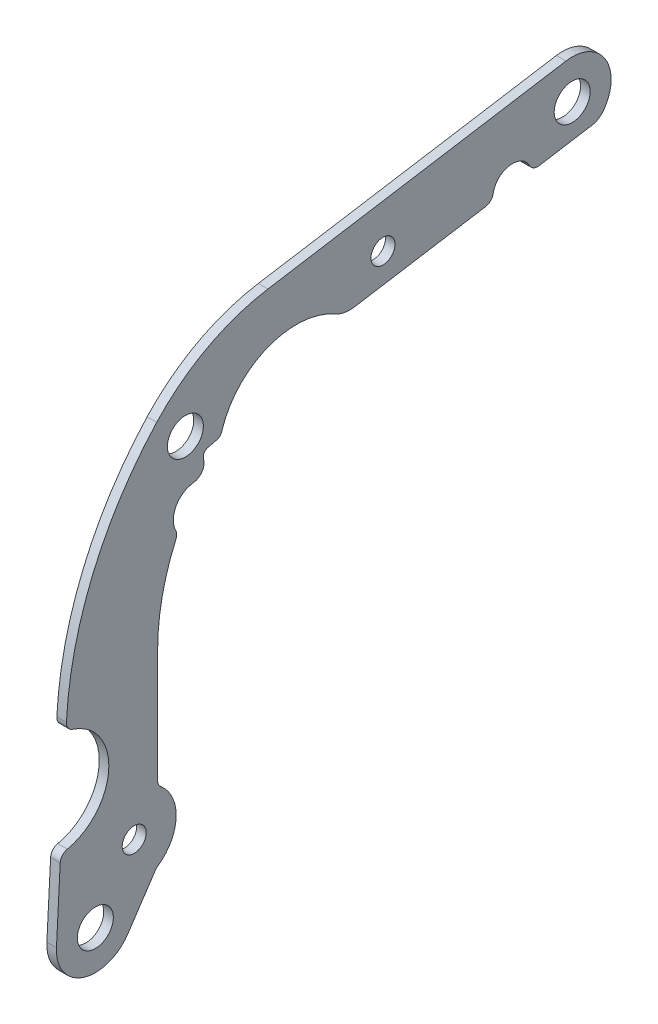
from build123d import *

# Parameters (mm, degrees)
EXTRUDE1_DEPTH            = 3.2
SKETCH5_R                 = 6
CHASSIS_MOUNT_HOLES_DEPTH = 244.405812041
SKETCH6_R                 = 4
ENGINE_MOUNT_HOLES_DEPTH  = 244.405812041
SKETCH7_R                 = 6.5
SKETCH7_R_2               = 7.5
BOSS_CLEARANCE_DEPTH      = 244.405812041
FILLET1_R                 = 3
FILLET2_R                 = 2
FILLET4_R                 = 4


with BuildPart() as part:
    # Sketch4 → Extrude1 (new body)
    with BuildSketch(Plane(origin=(0, 0, 0), x_dir=(0, 0, -1), z_dir=(1, 0, 0))):
        with BuildLine():
            Line((57.561676807, 155.782132528), (157.015436102, 171.930964589))
            ThreePointArc((157.015436102, 171.930964589), (170.191569786, 165.878071941), (169.567790519, 151.39156416))
            ThreePointArc((169.567790519, 151.39156416), (167.864843482, 149.829218431), (165.697709708, 149.026420829))
            Line((165.697709708, 149.026420829), (86.516546247, 136.169357202))
            ThreePointArc((86.516546247, 136.169357202), (83.134642067, 136.199619503), (79.956239663, 137.355452467))
            ThreePointArc((79.956239663, 137.355452467), (57.745458436, 139.047132616), (42.376364081, 122.923500175))
            ThreePointArc((42.376364081, 122.923500175), (41.240179336, 120.412740542), (39.600266647, 118.197900576))
            ThreePointArc((39.600266647, 118.197900576), (25.651951648, 95.833503084), (20.780663371, 69.92998369))
            Line((20.780663371, 69.92998369), (20.780663371, 30.61290747))
            ThreePointArc((20.780663371, 30.61290747), (26.962955948, 18.753205297), (20.37053182, 7.116486634))
            Line((20.37053182, 7.116486634), (10.815904153, -7.21222708))
            ThreePointArc((10.815904153, -7.21222708), (-4.092243171, -12.339106447), (-12.982184032, 0.680367435))
            Line((-12.982184032, 0.680367435), (-11.728287792, 24.606132992))
            ThreePointArc((-11.728287792, 24.606132992), (-11.013879957, 26.397161442), (-9.356926136, 27.383399496))
            ThreePointArc((-9.356926136, 27.383399496), (4.476016858, 43.584120766), (-7.587711328, 61.142029063))
            ThreePointArc((-7.587711328, 61.142029063), (-9.132498235, 62.296063238), (-9.655779017, 64.1519562))
            ThreePointArc((-9.655779017, 64.1519562), (-0.849075896, 102.602883239), (20.462203873, 135.797177398))
            ThreePointArc((20.462203873, 135.797177398), (37.331902598, 148.908426775), (57.561676807, 155.782132528))
        make_face()
    extrude(amount=EXTRUDE1_DEPTH)

    # Sketch5 → chassis mount holes (cut, through all)
    with BuildSketch(Plane(origin=(0, 0, 0), x_dir=(0, 0, -1), z_dir=(1, 0, 0))):
        Circle(SKETCH5_R)
        with Locations((159.099025767, 159.099025767)):
            Circle(SKETCH5_R)
        with Locations((30.03123526, 126.997538987)):
            Circle(SKETCH5_R)
    extrude(amount=CHASSIS_MOUNT_HOLES_DEPTH, mode=Mode.SUBTRACT)

    # Sketch6 → engine mount holes (cut, through all)
    with BuildSketch(Plane(origin=(0, 0, 0), x_dir=(0, 0, -1), z_dir=(1, 0, 0))):
        with Locations((12.965088215, 18.997538987)):
            Circle(SKETCH6_R)
        with Locations((95.975539476, 147.520941453)):
            Circle(SKETCH6_R)
    extrude(amount=ENGINE_MOUNT_HOLES_DEPTH, mode=Mode.SUBTRACT)

    # Sketch7 → boss clearance (cut, through all)
    with BuildSketch(Plane(origin=(0, 0, 0), x_dir=(0, 0, -1), z_dir=(1, 0, 0))):
        with Locations((139.146474391, 144.715156547)):
            Circle(SKETCH7_R)
        with Locations((33.517273096, 104.769234054)):
            Circle(SKETCH7_R_2)
        Polygon((35.588537275, 119.499655), (44.876445881, 121.763048067), (36.718478427, 114.862903962), align=None)
    extrude(amount=BOSS_CLEARANCE_DEPTH, mode=Mode.SUBTRACT)

    # Fillet1
    fillet1_edges = [part.edges().sort_by_distance(p)[0] for p in [
        (1.6, 30.61290747, -20.780663371),
        (1.6, 7.116486634, -20.37053182),
        (1.6, 143.673361714, -132.730504977),
        (1.6, 145.75695138, -145.562443806),
        (1.6, 100.236921904, -27.541643708),
    ]]
    fillet(fillet1_edges, radius=FILLET1_R)

    # Fillet2
    fillet2_edges = [part.edges().sort_by_distance(p)[0] for p in [
        (1.6, 120.949682485, -41.538773206),
        (1.6, 119.499655, -35.588537275),
    ]]
    fillet(fillet2_edges, radius=FILLET2_R)

    # Fillet4
    fillet4_edges = [part.edges().sort_by_distance(p)[0] for p in [
        (1.6, 114.862903962, -36.718478427),
    ]]
    fillet(fillet4_edges, radius=FILLET4_R)
    fillet4_2_edges = [part.edges().sort_by_distance(p)[0] for p in [
        (1.6, 112.183550135, -34.647723026),
    ]]
    fillet(fillet4_2_edges, radius=FILLET4_R - 0.0001)  # a hair under: the kernel refuses the full size


solid = part.part
